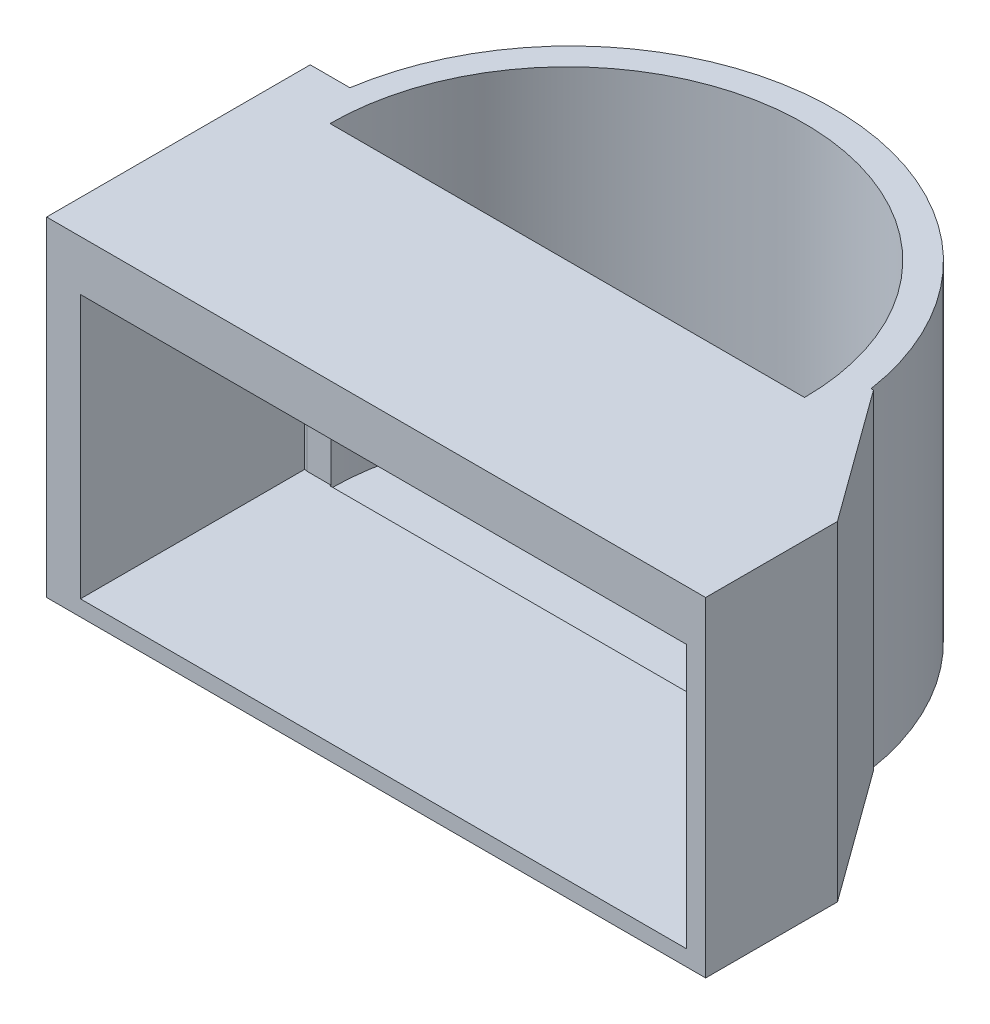
from build123d import *

# Parameters (mm, degrees)
CROQUIS1_W              = 50
CROQUIS1_H              = 20
SALIENTE_EXTRUIR1_DEPTH = 25
CROQUIS5_W              = 46
CROQUIS5_H              = 20
CORTAR_EXTRUIR1_DEPTH   = 17
SALIENTE_EXTRUIR2_DEPTH = 25
CORTAR_EXTRUIR5_DEPTH   = 24
CHAFL_N2_SIZE           = 10
CHAFL_N2_SIZE_2         = 7.26542528


with BuildPart() as part:
    # Croquis1 → Saliente-Extruir1 (new body)
    with BuildSketch(Plane(origin=(0, 0, 0), x_dir=(1, 0, 0), z_dir=(0, 1, 0))):
        Rectangle(CROQUIS1_W, CROQUIS1_H)
    extrude(amount=SALIENTE_EXTRUIR1_DEPTH)

    # Croquis5 → Cortar-Extruir1 (cut)
    with BuildSketch(Plane(origin=(0, 2.566177554, 10), x_dir=(1, 0, 0), z_dir=(0, 0, 1))):
        with Locations((0.564953321, 8.627432653)):
            Rectangle(CROQUIS5_W, CROQUIS5_H)
    extrude(amount=-CORTAR_EXTRUIR1_DEPTH, mode=Mode.SUBTRACT)

    # Croquis6 → Saliente-Extruir2 (add)
    with BuildSketch(Plane.XZ):
        with BuildLine():
            Line((-22.217043892, -6.976270562), (17.782956108, -6.976270562))
            ThreePointArc((17.782956108, -6.976270562), (-2.217043892, -26.976270562), (-22.217043892, -6.976270562))
        make_face()
    extrude(amount=-SALIENTE_EXTRUIR2_DEPTH)

    # Croquis11 → Cortar-Extruir5 (cut)
    with BuildSketch(Plane(origin=(0, 25, 0), x_dir=(1, 0, 0), z_dir=(0, 1, 0))):
        with BuildLine():
            Line((-20.391864193, 6.892929863), (15.608135807, 6.892929863))
            ThreePointArc((15.608135807, 6.892929863), (-2.391864193, 24.892929863), (-20.391864193, 6.892929863))
        make_face()
    extrude(amount=-CORTAR_EXTRUIR5_DEPTH, mode=Mode.SUBTRACT)

    # Chaflán2
    # the kernel refuses this chamfer: 10, 7.26542528 mm, written as the material it adds along each edge
    with BuildSketch(Plane(origin=(23.564953321, 1.193610207, -7), x_dir=(0.022768510603911864, 0, 0.9997407638607518), z_dir=(0, 1, 0))) as chafl_n2_piece_1:
        Polygon((CHAFL_N2_SIZE * 0.999740763861, -CHAFL_N2_SIZE * 0.0227685106039), (-CHAFL_N2_SIZE_2 * 0.0227685106041, -CHAFL_N2_SIZE_2 * 0.999740763868), (0, 0), align=None)
    extrude(amount=20)
    # the kernel refuses this chamfer: 10, 7.26542528 mm, written as the material it takes off along each edge
    with BuildSketch(Plane(origin=(25, -25.815709359, -10), x_dir=(0.022768510603911864, 0, 0.9997407638607518), z_dir=(0, 1, 0))) as chafl_n2_2_piece_1:
        Polygon((CHAFL_N2_SIZE * 0.999740763861, -CHAFL_N2_SIZE * 0.0227685106039), (-CHAFL_N2_SIZE_2 * 0.0227685106041, -CHAFL_N2_SIZE_2 * 0.999740763868), (0, 0), align=None)
    extrude(amount=76.631418718, mode=Mode.SUBTRACT)


solid = part.part
